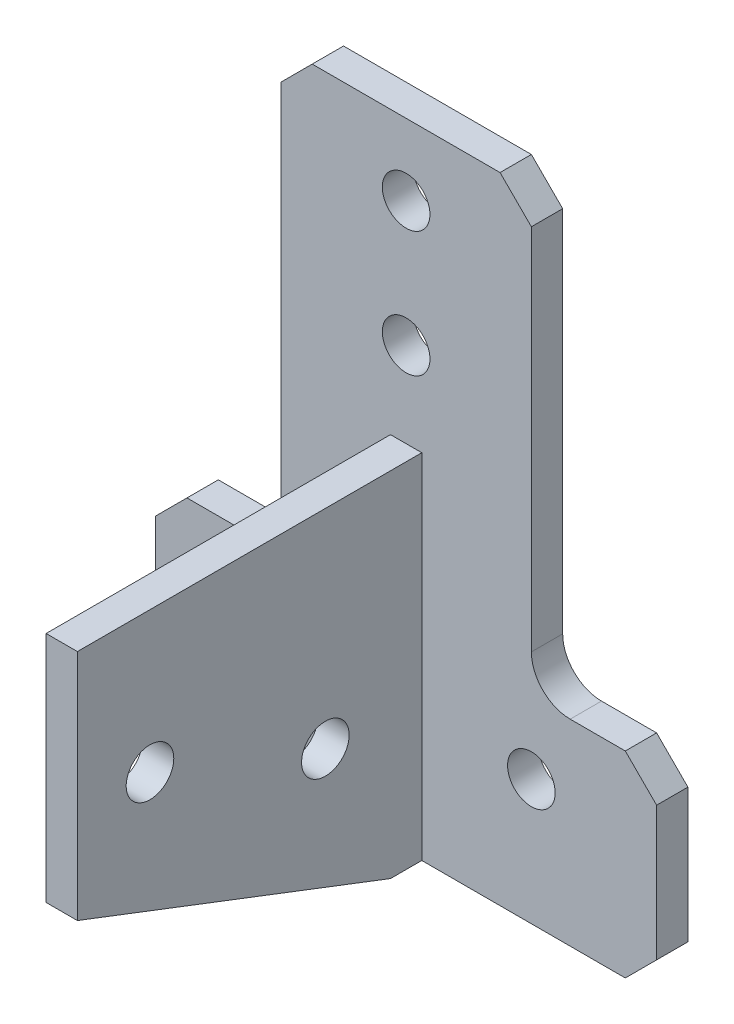
from build123d import *

# Parameters (mm, degrees)
BOSS_EXTRUDE1_DEPTH     = 64.389
CUT_EXTRUDE1_DEPTH      = 87.341811871
CUT_EXTRUDE1_DEPTH_BACK = 87.341811871
SKETCH7_W               = 47.625
SKETCH7_H               = 28.575
SKETCH8_W               = 12.7
SKETCH8_H               = 44.45
CUT_EXTRUDE2_DEPTH      = 85.512774787
CHAMFER1_SIZE           = 44.45
CHAMFER1_SIZE2          = 17.062756357
SKETCH4_R               = 2.413
CUT_EXTRUDE3_DEPTH      = 85.512774787
SKETCH9_R               = 2.413
CUT_EXTRUDE5_DEPTH      = 85.512774787
SKETCH10_R              = 2.413
CUT_EXTRUDE6_DEPTH      = 87.341811871
FILLET1_R               = 3.937
CHAMFER2_SIZE           = 3.175


with BuildPart() as part:
    # Sketch1 → Boss-Extrude1 (new body)
    with BuildSketch(Plane(origin=(0, 0, 0), x_dir=(1, 0, 0), z_dir=(0, 1, 0))):
        Polygon((3.175, 47.625), (26.9875, 47.625), (26.9875, 50.8), (-23.8125, 50.8), (-23.8125, 47.625), (0, 47.625), (0, 0), (3.175, 0), align=None)
    extrude(amount=BOSS_EXTRUDE1_DEPTH)

    # Sketch7 → Cut-Extrude1 (cut, two sides: drawn at the far end of the back side and taken through both)
    with BuildSketch(Plane.ZY.offset(-CUT_EXTRUDE1_DEPTH_BACK)):
        with Locations((-23.8125, 50.1015)):
            Rectangle(SKETCH7_W, SKETCH7_H)
    extrude(amount=CUT_EXTRUDE1_DEPTH + CUT_EXTRUDE1_DEPTH_BACK, mode=Mode.SUBTRACT)

    # Sketch8 → Cut-Extrude2 (cut, through all)
    with BuildSketch(Plane.XY.offset(-47.625)):
        with Locations((20.6375, 42.164)):
            Rectangle(SKETCH8_W, SKETCH8_H)
        with Locations((-17.4625, 42.164)):
            Rectangle(SKETCH8_W, SKETCH8_H)
    extrude(amount=-CUT_EXTRUDE2_DEPTH, mode=Mode.SUBTRACT)

    # Chamfer1
    chamfer1_edges = [part.edges().sort_by_distance(p)[0] for p in [
        (1.5875, 0, 0),
    ]]
    chamfer1_side = [part.faces().sort_by_distance(p)[0] for p in [
        (1.5875, 0, -36.922177419),
    ]]
    chamfer(chamfer1_edges, length=CHAMFER1_SIZE, length2=CHAMFER1_SIZE2, reference=chamfer1_side[0])

    # Sketch4 → Cut-Extrude3 (cut, through all)
    with BuildSketch(Plane.XY.offset(-47.625)):
        with Locations((14.2875, 12.7)):
            Circle(SKETCH4_R)
        with Locations((-11.1125, 12.7)):
            Circle(SKETCH4_R)
    extrude(amount=-CUT_EXTRUDE3_DEPTH, mode=Mode.SUBTRACT)

    # Sketch9 → Cut-Extrude5 (cut, through all)
    with BuildSketch(Plane.XY.offset(-47.625)):
        with Locations((1.5875, 57.15)):
            Circle(SKETCH9_R)
        with Locations((1.5875, 44.45)):
            Circle(SKETCH9_R)
    extrude(amount=-CUT_EXTRUDE5_DEPTH, mode=Mode.SUBTRACT)

    # Sketch10 → Cut-Extrude6 (cut, through all)
    with BuildSketch(Plane(origin=(3.175, 0, 0), x_dir=(0, 0, -1), z_dir=(1, 0, 0))):
        with Locations((37.846, 14.70914)):
            Circle(SKETCH10_R)
        with Locations((20.061292875, 21.536049439)):
            Circle(SKETCH10_R)
        Polygon((12.7, 35.814), (12.7, 12.187683112), (0, 17.062756357), (0, 35.814), align=None)
    extrude(amount=-CUT_EXTRUDE6_DEPTH, mode=Mode.SUBTRACT)

    # Fillet1
    fillet1_edges = [part.edges().sort_by_distance(p)[0] for p in [
        (-11.1125, 19.939, -49.2125),
        (14.2875, 19.939, -49.2125),
    ]]
    fillet(fillet1_edges, radius=FILLET1_R)

    # Chamfer2
    chamfer2_edges = [part.edges().sort_by_distance(p)[0] for p in [
        (-11.1125, 64.389, -49.2125),
        (14.2875, 64.389, -49.2125),
        (26.9875, 19.939, -49.2125),
        (26.9875, 0, -49.2125),
        (-23.8125, 0, -49.2125),
        (-23.8125, 19.939, -49.2125),
    ]]
    chamfer(chamfer2_edges, length=CHAMFER2_SIZE)


solid = part.part
